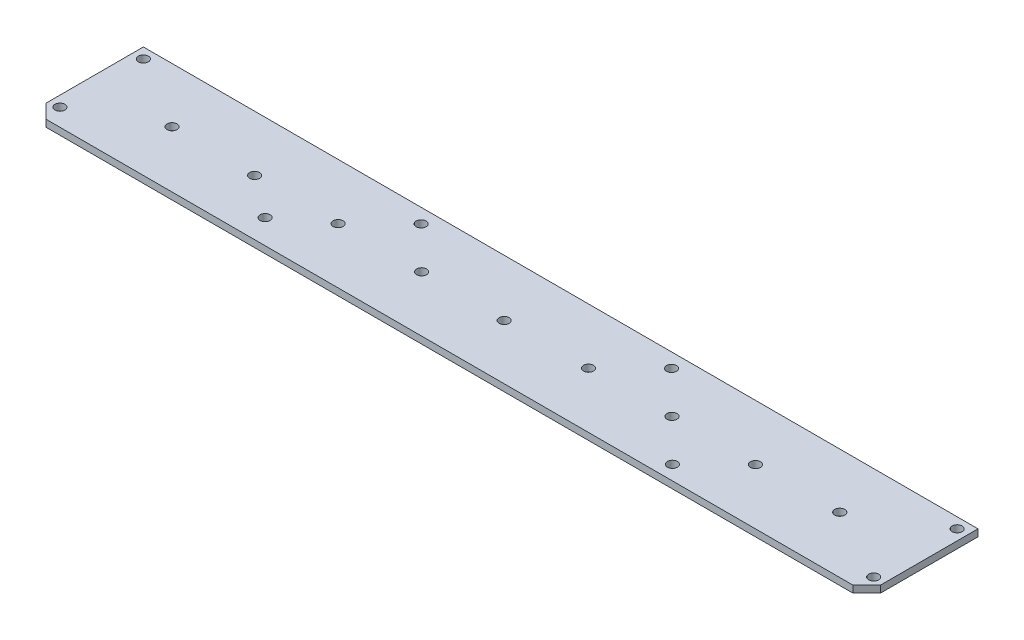
from build123d import *

# Parameters (mm, degrees)
SKETCH2_W           = 381
SKETCH2_H           = 50.8
BOSS_EXTRUDE1_DEPTH = 3.175
CUT_EXTRUDE1_REACH  = 386.385
SKETCH3_R           = 2.286


with BuildPart() as part:
    # Sketch2 → Boss-Extrude1 (new body)
    with BuildSketch(Plane(origin=(0, 0, 0), x_dir=(1, 0, 0), z_dir=(0, 1, 0))):
        with Locations((190.5, 25.4)):
            Rectangle(SKETCH2_W, SKETCH2_H)
    extrude(amount=BOSS_EXTRUDE1_DEPTH)

    # Sketch3 → Cut-Extrude1 (cut, up to next)
    with BuildSketch(Plane(origin=(0, 3.175, 0), x_dir=(1, 0, 0), z_dir=(0, 1, 0)), mode=Mode.PRIVATE) as cut_extrude1_sk1:
        with Locations((190.5, 25.003125)):
            Circle(SKETCH3_R)
    cut_extrude1_tool1 = extrude(cut_extrude1_sk1.sketch, amount=-CUT_EXTRUDE1_REACH, mode=Mode.PRIVATE) & part.part
    # Sketch3 → Cut-Extrude1 (cut, up to next)
    with BuildSketch(Plane(origin=(0, 3.175, 0), x_dir=(1, 0, 0), z_dir=(0, 1, 0)), mode=Mode.PRIVATE) as cut_extrude1_sk2:
        with Locations((38.1, 25.796875)):
            Circle(SKETCH3_R)
    cut_extrude1_tool2 = extrude(cut_extrude1_sk2.sketch, amount=-CUT_EXTRUDE1_REACH, mode=Mode.PRIVATE) & part.part
    # Sketch3 → Cut-Extrude1 (cut, up to next)
    with BuildSketch(Plane(origin=(0, 3.175, 0), x_dir=(1, 0, 0), z_dir=(0, 1, 0)), mode=Mode.PRIVATE) as cut_extrude1_sk3:
        with Locations((114.3, 25.4)):
            Circle(SKETCH3_R)
    cut_extrude1_tool3 = extrude(cut_extrude1_sk3.sketch, amount=-CUT_EXTRUDE1_REACH, mode=Mode.PRIVATE) & part.part
    # Sketch3 → Cut-Extrude1 (cut, up to next)
    with BuildSketch(Plane(origin=(0, 3.175, 0), x_dir=(1, 0, 0), z_dir=(0, 1, 0)), mode=Mode.PRIVATE) as cut_extrude1_sk4:
        with Locations((76.2, 25.4)):
            Circle(SKETCH3_R)
    cut_extrude1_tool4 = extrude(cut_extrude1_sk4.sketch, amount=-CUT_EXTRUDE1_REACH, mode=Mode.PRIVATE) & part.part
    # Sketch3 → Cut-Extrude1 (cut, up to next)
    with BuildSketch(Plane(origin=(0, 3.175, 0), x_dir=(1, 0, 0), z_dir=(0, 1, 0)), mode=Mode.PRIVATE) as cut_extrude1_sk5:
        with Locations((152.4, 25.4)):
            Circle(SKETCH3_R)
    cut_extrude1_tool5 = extrude(cut_extrude1_sk5.sketch, amount=-CUT_EXTRUDE1_REACH, mode=Mode.PRIVATE) & part.part
    # Sketch3 → Cut-Extrude1 (cut, up to next)
    with BuildSketch(Plane(origin=(0, 3.175, 0), x_dir=(1, 0, 0), z_dir=(0, 1, 0)), mode=Mode.PRIVATE) as cut_extrude1_sk6:
        with Locations((228.6, 25.4)):
            Circle(SKETCH3_R)
    cut_extrude1_tool6 = extrude(cut_extrude1_sk6.sketch, amount=-CUT_EXTRUDE1_REACH, mode=Mode.PRIVATE) & part.part
    # Sketch3 → Cut-Extrude1 (cut, up to next)
    with BuildSketch(Plane(origin=(0, 3.175, 0), x_dir=(1, 0, 0), z_dir=(0, 1, 0)), mode=Mode.PRIVATE) as cut_extrude1_sk7:
        with Locations((304.8, 25.4)):
            Circle(SKETCH3_R)
    cut_extrude1_tool7 = extrude(cut_extrude1_sk7.sketch, amount=-CUT_EXTRUDE1_REACH, mode=Mode.PRIVATE) & part.part
    # Sketch3 → Cut-Extrude1 (cut, up to next)
    with BuildSketch(Plane(origin=(0, 3.175, 0), x_dir=(1, 0, 0), z_dir=(0, 1, 0)), mode=Mode.PRIVATE) as cut_extrude1_sk8:
        with Locations((266.7, 25.4)):
            Circle(SKETCH3_R)
    cut_extrude1_tool8 = extrude(cut_extrude1_sk8.sketch, amount=-CUT_EXTRUDE1_REACH, mode=Mode.PRIVATE) & part.part
    # Sketch3 → Cut-Extrude1 (cut, up to next)
    with BuildSketch(Plane(origin=(0, 3.175, 0), x_dir=(1, 0, 0), z_dir=(0, 1, 0)), mode=Mode.PRIVATE) as cut_extrude1_sk9:
        with Locations((342.9, 25.796875)):
            Circle(SKETCH3_R)
    cut_extrude1_tool9 = extrude(cut_extrude1_sk9.sketch, amount=-CUT_EXTRUDE1_REACH, mode=Mode.PRIVATE) & part.part
    # Sketch3 → Cut-Extrude1 (cut, up to next)
    with BuildSketch(Plane(origin=(0, 3.175, 0), x_dir=(1, 0, 0), z_dir=(0, 1, 0)), mode=Mode.PRIVATE) as cut_extrude1_sk10:
        with Locations((247.65, 44.252590674)):
            Circle(SKETCH3_R)
    cut_extrude1_tool10 = extrude(cut_extrude1_sk10.sketch, amount=-CUT_EXTRUDE1_REACH, mode=Mode.PRIVATE) & part.part
    # Sketch3 → Cut-Extrude1 (cut, up to next)
    with BuildSketch(Plane(origin=(0, 3.175, 0), x_dir=(1, 0, 0), z_dir=(0, 1, 0)), mode=Mode.PRIVATE) as cut_extrude1_sk11:
        with Locations((285.75, 6.547409326)):
            Circle(SKETCH3_R)
    cut_extrude1_tool11 = extrude(cut_extrude1_sk11.sketch, amount=-CUT_EXTRUDE1_REACH, mode=Mode.PRIVATE) & part.part
    # Sketch3 → Cut-Extrude1 (cut, up to next)
    with BuildSketch(Plane(origin=(0, 3.175, 0), x_dir=(1, 0, 0), z_dir=(0, 1, 0)), mode=Mode.PRIVATE) as cut_extrude1_sk12:
        with Locations((133.35, 44.252590674)):
            Circle(SKETCH3_R)
    cut_extrude1_tool12 = extrude(cut_extrude1_sk12.sketch, amount=-CUT_EXTRUDE1_REACH, mode=Mode.PRIVATE) & part.part
    # Sketch3 → Cut-Extrude1 (cut, up to next)
    with BuildSketch(Plane(origin=(0, 3.175, 0), x_dir=(1, 0, 0), z_dir=(0, 1, 0)), mode=Mode.PRIVATE) as cut_extrude1_sk13:
        with Locations((4.7625, 46.0375)):
            Circle(SKETCH3_R)
    cut_extrude1_tool13 = extrude(cut_extrude1_sk13.sketch, amount=-CUT_EXTRUDE1_REACH, mode=Mode.PRIVATE) & part.part
    # Sketch3 → Cut-Extrude1 (cut, up to next)
    with BuildSketch(Plane(origin=(0, 3.175, 0), x_dir=(1, 0, 0), z_dir=(0, 1, 0)), mode=Mode.PRIVATE) as cut_extrude1_sk14:
        with Locations((4.7625, 7.9375)):
            Circle(SKETCH3_R)
    cut_extrude1_tool14 = extrude(cut_extrude1_sk14.sketch, amount=-CUT_EXTRUDE1_REACH, mode=Mode.PRIVATE) & part.part
    # Sketch3 → Cut-Extrude1 (cut, up to next)
    with BuildSketch(Plane(origin=(0, 3.175, 0), x_dir=(1, 0, 0), z_dir=(0, 1, 0)), mode=Mode.PRIVATE) as cut_extrude1_sk15:
        with Locations((376.2375, 7.9375)):
            Circle(SKETCH3_R)
    cut_extrude1_tool15 = extrude(cut_extrude1_sk15.sketch, amount=-CUT_EXTRUDE1_REACH, mode=Mode.PRIVATE) & part.part
    # Sketch3 → Cut-Extrude1 (cut, up to next)
    with BuildSketch(Plane(origin=(0, 3.175, 0), x_dir=(1, 0, 0), z_dir=(0, 1, 0)), mode=Mode.PRIVATE) as cut_extrude1_sk16:
        with Locations((376.2375, 46.0375)):
            Circle(SKETCH3_R)
    cut_extrude1_tool16 = extrude(cut_extrude1_sk16.sketch, amount=-CUT_EXTRUDE1_REACH, mode=Mode.PRIVATE) & part.part
    # Sketch3 → Cut-Extrude1 (cut, up to next)
    with BuildSketch(Plane(origin=(0, 3.175, 0), x_dir=(1, 0, 0), z_dir=(0, 1, 0)), mode=Mode.PRIVATE) as cut_extrude1_sk17:
        with Locations((95.25, 11.1125)):
            Circle(SKETCH3_R)
    cut_extrude1_tool17 = extrude(cut_extrude1_sk17.sketch, amount=-CUT_EXTRUDE1_REACH, mode=Mode.PRIVATE) & part.part
    # Sketch3 → Cut-Extrude1 (cut, up to next)
    with BuildSketch(Plane(origin=(0, 3.175, 0), x_dir=(1, 0, 0), z_dir=(0, 1, 0)), mode=Mode.PRIVATE) as cut_extrude1_sk18:
        Polygon((0, 6.35), (6.35, 0), (0, 0), align=None)
    cut_extrude1_tool18 = extrude(cut_extrude1_sk18.sketch, amount=-CUT_EXTRUDE1_REACH, mode=Mode.PRIVATE) & part.part
    # Sketch3 → Cut-Extrude1 (cut, up to next)
    with BuildSketch(Plane(origin=(0, 3.175, 0), x_dir=(1, 0, 0), z_dir=(0, 1, 0)), mode=Mode.PRIVATE) as cut_extrude1_sk19:
        Polygon((374.65, 0), (381, 0), (381, 6.35), align=None)
    cut_extrude1_tool19 = extrude(cut_extrude1_sk19.sketch, amount=-CUT_EXTRUDE1_REACH, mode=Mode.PRIVATE) & part.part
    add(cut_extrude1_tool1.solids().sort_by_distance((190.5, 3.175, -25.003125))[0], mode=Mode.SUBTRACT)
    add(cut_extrude1_tool2.solids().sort_by_distance((38.1, 3.175, -25.796875))[0], mode=Mode.SUBTRACT)
    add(cut_extrude1_tool3.solids().sort_by_distance((114.3, 3.175, -25.4))[0], mode=Mode.SUBTRACT)
    add(cut_extrude1_tool4.solids().sort_by_distance((76.2, 3.175, -25.4))[0], mode=Mode.SUBTRACT)
    add(cut_extrude1_tool5.solids().sort_by_distance((152.4, 3.175, -25.4))[0], mode=Mode.SUBTRACT)
    add(cut_extrude1_tool6.solids().sort_by_distance((228.6, 3.175, -25.4))[0], mode=Mode.SUBTRACT)
    add(cut_extrude1_tool7.solids().sort_by_distance((304.8, 3.175, -25.4))[0], mode=Mode.SUBTRACT)
    add(cut_extrude1_tool8.solids().sort_by_distance((266.7, 3.175, -25.4))[0], mode=Mode.SUBTRACT)
    add(cut_extrude1_tool9.solids().sort_by_distance((342.9, 3.175, -25.796875))[0], mode=Mode.SUBTRACT)
    add(cut_extrude1_tool10.solids().sort_by_distance((247.65, 3.175, -44.252591))[0], mode=Mode.SUBTRACT)
    add(cut_extrude1_tool11.solids().sort_by_distance((285.75, 3.175, -6.547409))[0], mode=Mode.SUBTRACT)
    add(cut_extrude1_tool12.solids().sort_by_distance((133.35, 3.175, -44.252591))[0], mode=Mode.SUBTRACT)
    add(cut_extrude1_tool13.solids().sort_by_distance((4.7625, 3.175, -46.0375))[0], mode=Mode.SUBTRACT)
    add(cut_extrude1_tool14.solids().sort_by_distance((4.7625, 3.175, -7.9375))[0], mode=Mode.SUBTRACT)
    add(cut_extrude1_tool15.solids().sort_by_distance((376.2375, 3.175, -7.9375))[0], mode=Mode.SUBTRACT)
    add(cut_extrude1_tool16.solids().sort_by_distance((376.2375, 3.175, -46.0375))[0], mode=Mode.SUBTRACT)
    add(cut_extrude1_tool17.solids().sort_by_distance((95.25, 3.175, -11.1125))[0], mode=Mode.SUBTRACT)
    add(cut_extrude1_tool18.solids().sort_by_distance((2.116667, 3.175, -2.116667))[0], mode=Mode.SUBTRACT)
    add(cut_extrude1_tool19.solids().sort_by_distance((378.883333, 3.175, -2.116667))[0], mode=Mode.SUBTRACT)


solid = part.part
